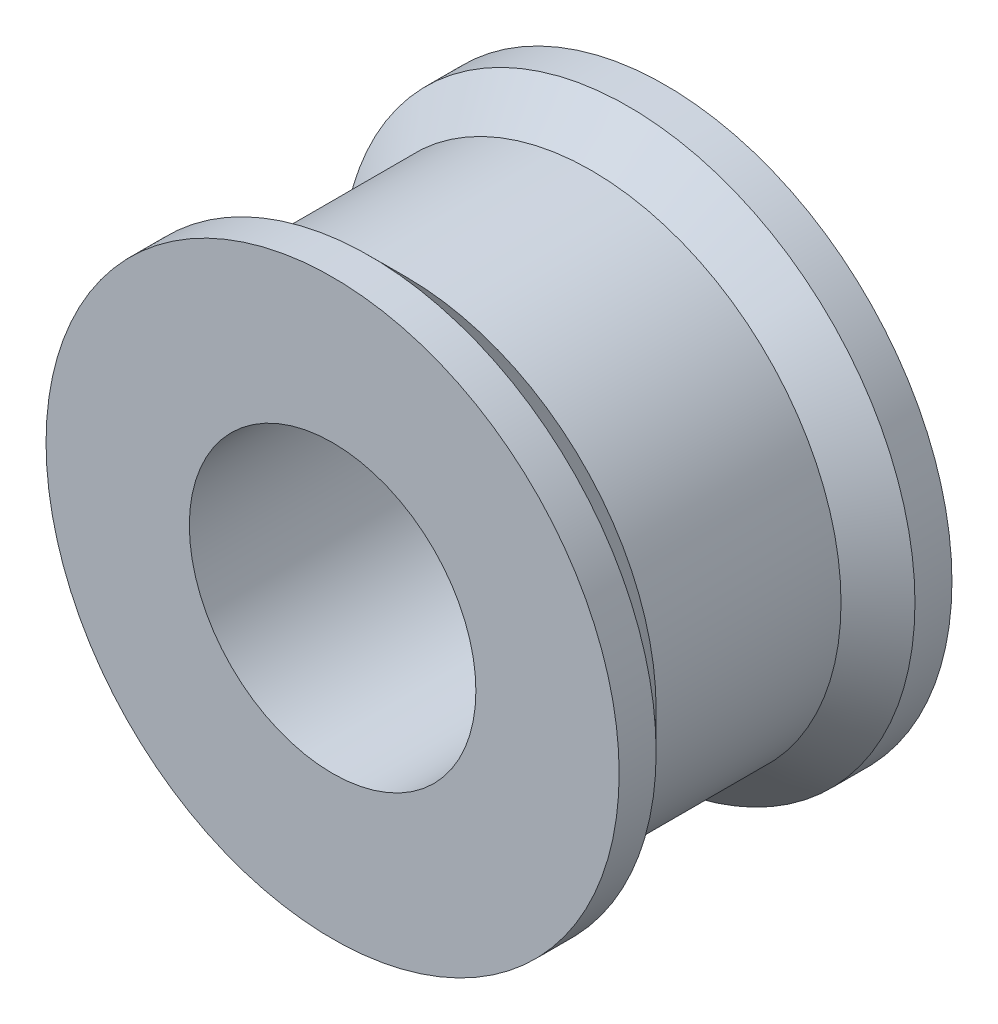
from build123d import *

# Parameters (mm, degrees)
SKETCH1_R           = 7.75
SKETCH1_R_2         = 3.875
BOSS_EXTRUDE1_DEPTH = 1
SKETCH2_R           = 6.75
SKETCH2_R_2         = 3.875
BOSS_EXTRUDE2_DEPTH = 3.5
CHAMFER1_SIZE       = 1


with BuildPart() as part:
    # Sketch1 → Boss-Extrude1 (new body)
    with BuildSketch(Plane.XY):
        Circle(SKETCH1_R)
        Circle(SKETCH1_R_2, mode=Mode.SUBTRACT)
    extrude(amount=BOSS_EXTRUDE1_DEPTH)

    # Sketch2 → Boss-Extrude2 (add)
    with BuildSketch(Plane.XY.offset(1)):
        Circle(SKETCH2_R)
        Circle(SKETCH2_R_2, mode=Mode.SUBTRACT)
    extrude(amount=BOSS_EXTRUDE2_DEPTH)

    # Chamfer1
    chamfer1_edges = [part.edges().sort_by_distance(p)[0] for p in [
        (-6.75, 0, 1),
    ]]
    chamfer(chamfer1_edges, length=CHAMFER1_SIZE - 0.0001)  # a hair under: the kernel refuses the full size

    # Mirror5: part across plane


with BuildPart() as part_1:
    add(part.part)
    add(part.part.mirror(Plane.XY.offset(4.5)))


solid = part_1.part
